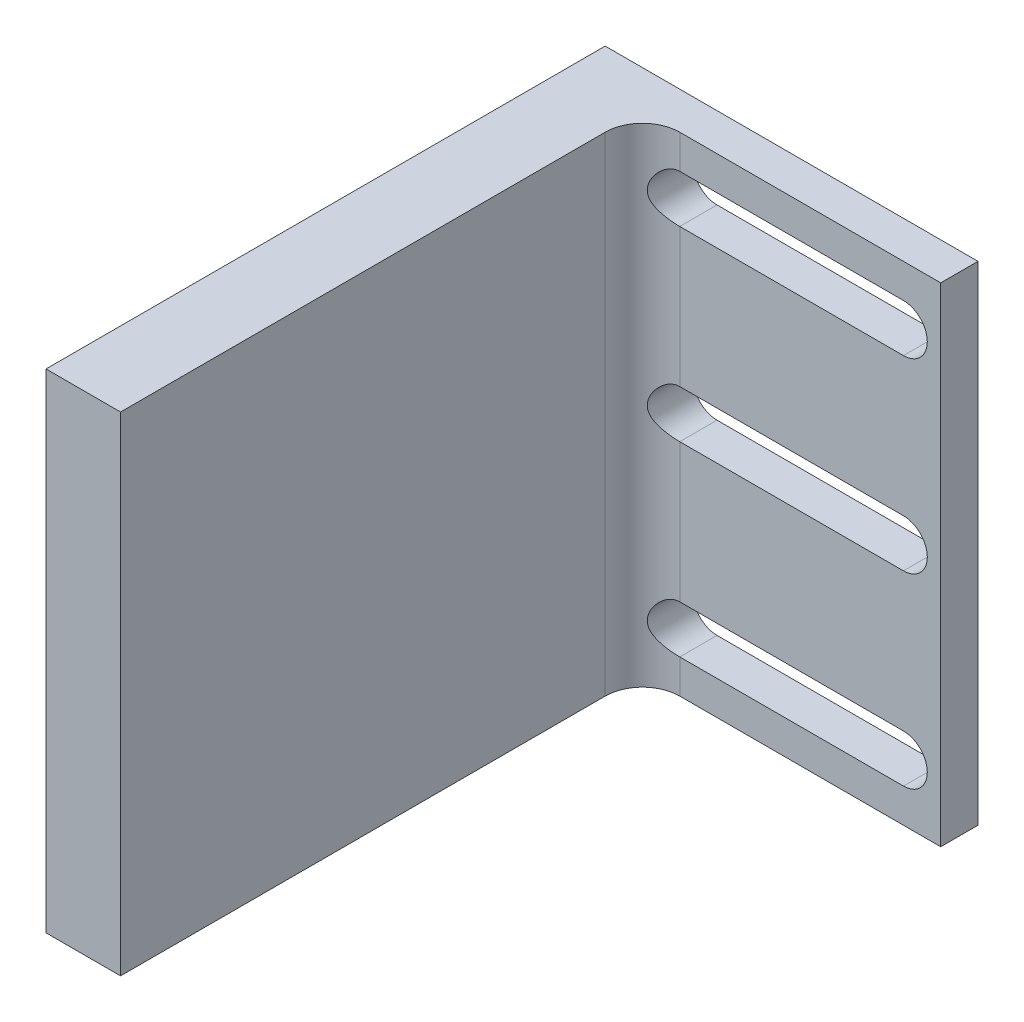
from build123d import *

# Parameters (mm, degrees)
SKETCH_1_W          = 50
SKETCH_1_H          = 65.5
EXTRUDE_1_DEPTH     = 5
SKETCH_4_W          = 10
SKETCH_4_H          = 65.5
EXTRUDE_2_DEPTH     = 70
CUT_EXTRUDE_1_DEPTH = 5
FILLET_7_R          = 5


with BuildPart() as part:
    # 스케치1 → 보스-돌출1 (new body)
    with BuildSketch(Plane.XY):
        Rectangle(SKETCH_1_W, SKETCH_1_H)
    extrude(amount=EXTRUDE_1_DEPTH)

    # 스케치4 → 보스-돌출2 (add)
    with BuildSketch(Plane.XY.offset(5)):
        with Locations((-20, 0)):
            Rectangle(SKETCH_4_W, SKETCH_4_H)
    extrude(amount=EXTRUDE_2_DEPTH)

    # 스케치2 → 컷-돌출1 (cut)
    with BuildSketch(Plane.XY.offset(5)):
        with BuildLine():
            Line((-10, -28.2), (20, -28.2))
            ThreePointArc((20, -28.2), (23.2, -25), (20, -21.8))
            Line((20, -21.8), (-10, -21.8))
            ThreePointArc((-10, -21.8), (-13.2, -25), (-10, -28.2))
        make_face()
        with BuildLine():
            Line((-10, -3.2), (20, -3.2))
            ThreePointArc((20, -3.2), (23.2, 0), (20, 3.2))
            Line((20, 3.2), (-10, 3.2))
            ThreePointArc((-10, 3.2), (-13.2, 0), (-10, -3.2))
        make_face()
        with BuildLine():
            Line((-10, 21.8), (20, 21.8))
            ThreePointArc((20, 21.8), (23.2, 25), (20, 28.2))
            Line((20, 28.2), (-10, 28.2))
            ThreePointArc((-10, 28.2), (-13.2, 25), (-10, 21.8))
        make_face()
    extrude(amount=-CUT_EXTRUDE_1_DEPTH, mode=Mode.SUBTRACT)

    # 필렛7
    # the kernel refuses this fillet: 5 mm, written as the material it adds along each edge
    with BuildSketch(Plane(origin=(-15, -32.75, 5), x_dir=(0, 0, 1), z_dir=(0, 1, 0))) as fillet_7_piece_1_section:
        with BuildLine():
            CenterArc((FILLET_7_R, FILLET_7_R), FILLET_7_R, 180, 90)
            Line((0, FILLET_7_R), (0, 0))
            Line((0, 0), (FILLET_7_R, 0))
        make_face()
    fillet_7_piece_1 = extrude(amount=65.5, mode=Mode.PRIVATE)
    fillet_7_piece_1 = fillet_7_piece_1 - Plane(origin=(-10, -25, 6.131975571), x_dir=(0, 1, 0), z_dir=(0, 0, 1)) * Cylinder(3.2, 151, mode=Mode.PRIVATE)
    fillet_7_piece_1 = fillet_7_piece_1 - Plane(origin=(-10, 0, 6.131975571), x_dir=(0, 1, 0), z_dir=(0, 0, 1)) * Cylinder(3.2, 151, mode=Mode.PRIVATE)
    fillet_7_piece_1 = fillet_7_piece_1 - Plane(origin=(-10, 25, 6.131975571), x_dir=(0, 1, 0), z_dir=(0, 0, 1)) * Cylinder(3.2, 151, mode=Mode.PRIVATE)
    add(fillet_7_piece_1)


solid = part.part
